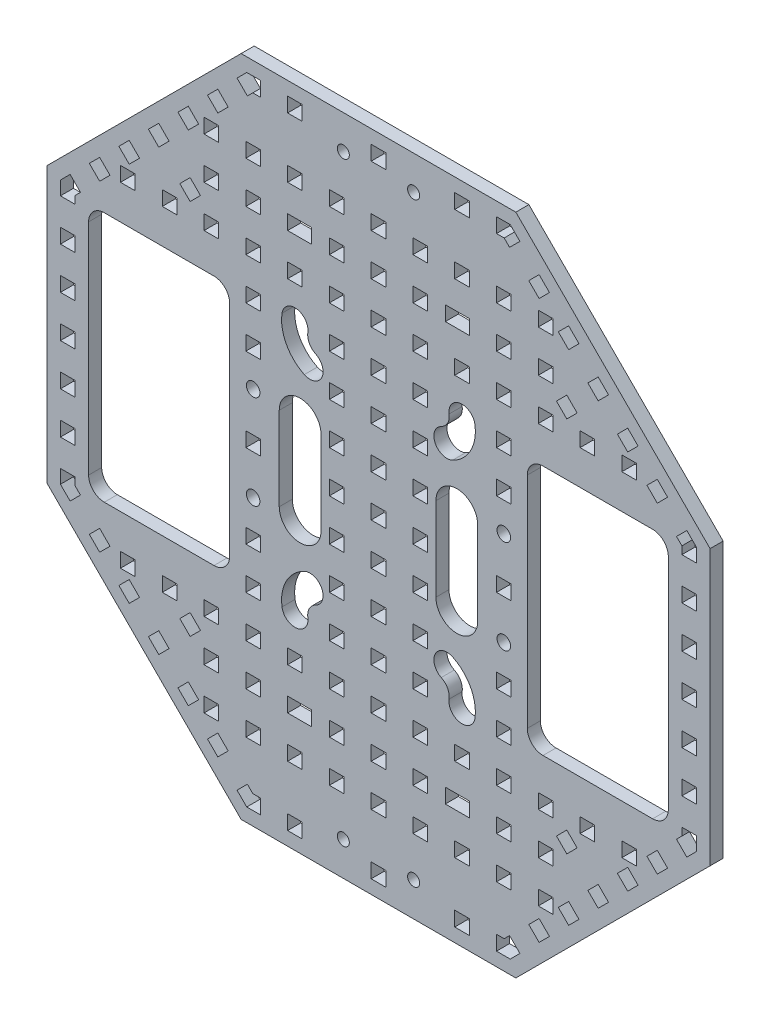
from build123d import *

# Parameters (mm, degrees)
RESSALTO_EXTRUS_O1_DEPTH = 2.5
ESBO_O2_R                = 1.3
ESBO_O2_R_2              = 1.15
CORTE_EXTRUS_O1_DEPTH    = 90.837353033
CORTE_EXTRUS_O2_DEPTH    = 10.5
ESBO_O5_W                = 2.8
ESBO_O5_H                = 2.8
CORTE_EXTRUS_O3_DEPTH    = 90.837353033
ESBO_O6_W                = 2.8
ESBO_O6_H                = 2.8
CORTE_EXTRUS_O4_DEPTH    = 90.837353033


with BuildPart() as part:
    # Esboço1 → Ressalto-extrusão1 (new body)
    with BuildSketch(Plane.XY):
        Polygon((63.5, -26.302561211), (63.5, 26.302561211), (26.302561211, 63.5), (-26.302561211, 63.5), (-63.5, 26.302561211), (-63.5, -26.302561211), (-26.302561211, -63.5), (26.302561211, -63.5), align=None)
    extrude(amount=RESSALTO_EXTRUS_O1_DEPTH)

    # Esboço2 → Corte-extrusão1 (cut, through all)
    with BuildSketch(Plane(origin=(0, 0, 0), x_dir=(-1, 0, 0), z_dir=(0, 0, -1))):
        with Locations((24, 9)):
            Circle(ESBO_O2_R)
        with Locations((24, -9)):
            Circle(ESBO_O2_R)
        with Locations((-24, -9)):
            Circle(ESBO_O2_R)
        with Locations((-24, 9)):
            Circle(ESBO_O2_R)
        with Locations((-6.731, -57)):
            Circle(ESBO_O2_R_2)
        with Locations((6.731, -57)):
            Circle(ESBO_O2_R_2)
        with Locations((6.731, 57)):
            Circle(ESBO_O2_R_2)
        with Locations((-6.731, 57)):
            Circle(ESBO_O2_R_2)
        with BuildLine():
            Line((52.5, 24), (31.5, 24))
            ThreePointArc((31.5, 24), (29.378679656, 23.121320344), (28.5, 21))
            Line((28.5, 21), (28.5, -21))
            ThreePointArc((28.5, -21), (29.378679656, -23.121320344), (31.5, -24))
            Line((31.5, -24), (52.5, -24))
            ThreePointArc((52.5, -24), (54.621320344, -23.121320344), (55.5, -21))
            Line((55.5, -21), (55.5, 21))
            ThreePointArc((55.5, 21), (54.621320344, 23.121320344), (52.5, 24))
        make_face()
        with BuildLine():
            Line((-28.5, 21), (-28.5, -21))
            ThreePointArc((-28.5, -21), (-29.378679656, -23.121320344), (-31.5, -24))
            Line((-31.5, -24), (-52.5, -24))
            ThreePointArc((-52.5, -24), (-54.621320344, -23.121320344), (-55.5, -21))
            Line((-55.5, -21), (-55.5, 21))
            ThreePointArc((-55.5, 21), (-54.621320344, 23.121320344), (-52.5, 24))
            Line((-52.5, 24), (-31.5, 24))
            ThreePointArc((-31.5, 24), (-29.378679656, 23.121320344), (-28.5, 21))
        make_face()
    extrude(amount=-CORTE_EXTRUS_O1_DEPTH, mode=Mode.SUBTRACT)

    # Esboço4 → Corte-extrusão2 (cut)
    with BuildSketch(Plane.XY.offset(2.5)):
        Polygon((-36.062445841, 34.082546853), (-34.082546853, 36.062445841), (-36.062445841, 38.042344828), (-38.042344828, 36.062445841), align=None)
        Polygon((36.062445841, 34.082546853), (38.042344828, 36.062445841), (36.062445841, 38.042344828), (34.082546853, 36.062445841), align=None)
        Polygon((36.062445841, -38.042344828), (38.042344828, -36.062445841), (36.062445841, -34.082546853), (34.082546853, -36.062445841), align=None)
        Polygon((-36.062445841, -38.042344828), (-34.082546853, -36.062445841), (-36.062445841, -34.082546853), (-38.042344828, -36.062445841), align=None)
    extrude(amount=-CORTE_EXTRUS_O2_DEPTH, mode=Mode.SUBTRACT)

    # Esboço5 → Corte-extrusão3 (cut, through all)
    with BuildSketch(Plane(origin=(0, 0, 0), x_dir=(-1, 0, 0), z_dir=(0, 0, -1))):
        Polygon((-47.72970773, -34.436100244), (-49.709606717, -36.415999231), (-47.72970773, -38.395898218), (-45.749808743, -36.415999231), align=None)
        Polygon((-42.072853481, -40.092954493), (-44.052752468, -42.072853481), (-42.072853481, -44.052752468), (-40.092954493, -42.072853481), align=None)
        Polygon((-53.38656198, -28.779245994), (-55.366460967, -30.759144982), (-53.38656198, -32.739043969), (-51.406662992, -30.759144982), align=None)
        with Locations((-8, 24)):
            Rectangle(ESBO_O5_W, ESBO_O5_H)
        Polygon((-25.225605949, -60.9), (-27.082189719, -59.043416229), (-25.102290732, -57.063517242), (-24.065807974, -58.1), (-22.6, -58.1), (-22.6, -60.9), align=None)
        Polygon((-30.759144982, -55.366460967), (-32.739043969, -53.38656198), (-30.759144982, -51.406662992), (-28.779245994, -53.38656198), align=None)
        Polygon((-36.415999231, -49.709606717), (-38.395898218, -47.72970773), (-36.415999231, -45.749808743), (-34.436100244, -47.72970773), align=None)
        with Locations((-8, 8)):
            Rectangle(ESBO_O5_W, ESBO_O5_H)
        with Locations((0, -59.5)):
            Rectangle(ESBO_O5_W, ESBO_O5_H)
        with Locations((-16, -59.5)):
            Rectangle(ESBO_O5_W, ESBO_O5_H)
        with Locations((8, 24)):
            Rectangle(ESBO_O5_W, ESBO_O5_H)
        with Locations((-8, 0)):
            Rectangle(ESBO_O5_W, ESBO_O5_H)
        with Locations((8, -24)):
            Rectangle(ESBO_O5_W, ESBO_O5_H)
        with Locations((-8, -24)):
            Rectangle(ESBO_O5_W, ESBO_O5_H)
        with Locations((-8, -8)):
            Rectangle(ESBO_O5_W, ESBO_O5_H)
        Polygon((24.065807974, -58.1), (25.102290732, -57.063517242), (27.082189719, -59.043416229), (25.225605949, -60.9), (22.6, -60.9), (22.6, -58.1), align=None)
        Polygon((60.9, -25.225605949), (59.043416229, -27.082189719), (57.063517242, -25.102290732), (58.1, -24.065807974), (58.1, -22.6), (60.9, -22.6), align=None)
        with Locations((59.5, -8)):
            Rectangle(ESBO_O5_W, ESBO_O5_H)
        with Locations((59.5, 0)):
            Rectangle(ESBO_O5_W, ESBO_O5_H)
        with Locations((16, -59.5)):
            Rectangle(ESBO_O5_W, ESBO_O5_H)
        with Locations((8, -8)):
            Rectangle(ESBO_O5_W, ESBO_O5_H)
        Polygon((34.436100244, -47.72970773), (36.415999231, -49.709606717), (38.395898218, -47.72970773), (36.415999231, -45.749808743), align=None)
        Polygon((40.092954493, -42.072853481), (42.072853481, -44.052752468), (44.052752468, -42.072853481), (42.072853481, -40.092954493), align=None)
        Polygon((28.779245994, -53.38656198), (30.759144982, -55.366460967), (32.739043969, -53.38656198), (30.759144982, -51.406662992), align=None)
        Polygon((55.366460967, -30.759144982), (53.38656198, -32.739043969), (51.406662992, -30.759144982), (53.38656198, -28.779245994), align=None)
        Polygon((49.709606717, -36.415999231), (47.72970773, -38.395898218), (45.749808743, -36.415999231), (47.72970773, -34.436100244), align=None)
        with Locations((59.5, -16)):
            Rectangle(ESBO_O5_W, ESBO_O5_H)
        with Locations((8, 0)):
            Rectangle(ESBO_O5_W, ESBO_O5_H)
        Polygon((58.1, 24.065807974), (57.063517242, 25.102290732), (59.043416229, 27.082189719), (60.9, 25.225605949), (60.9, 22.6), (58.1, 22.6), align=None)
        Polygon((47.72970773, 34.436100244), (49.709606717, 36.415999231), (47.72970773, 38.395898218), (45.749808743, 36.415999231), align=None)
        Polygon((42.072853481, 40.092954493), (44.052752468, 42.072853481), (42.072853481, 44.052752468), (40.092954493, 42.072853481), align=None)
        Polygon((53.38656198, 28.779245994), (55.366460967, 30.759144982), (53.38656198, 32.739043969), (51.406662992, 30.759144982), align=None)
        with Locations((59.5, 16)):
            Rectangle(ESBO_O5_W, ESBO_O5_H)
        Polygon((25.225605949, 60.9), (27.082189719, 59.043416229), (25.102290732, 57.063517242), (24.065807974, 58.1), (22.6, 58.1), (22.6, 60.9), align=None)
        Polygon((30.759144982, 55.366460967), (32.739043969, 53.38656198), (30.759144982, 51.406662992), (28.779245994, 53.38656198), align=None)
        Polygon((36.415999231, 49.709606717), (38.395898218, 47.72970773), (36.415999231, 45.749808743), (34.436100244, 47.72970773), align=None)
        with Locations((8, 8)):
            Rectangle(ESBO_O5_W, ESBO_O5_H)
        with Locations((16, 59.5)):
            Rectangle(ESBO_O5_W, ESBO_O5_H)
        with Locations((59.5, 8)):
            Rectangle(ESBO_O5_W, ESBO_O5_H)
        Polygon((-24.065807974, 58.1), (-25.102290732, 57.063517242), (-27.082189719, 59.043416229), (-25.225605949, 60.9), (-22.6, 60.9), (-22.6, 58.1), align=None)
        with Locations((-16, 59.5)):
            Rectangle(ESBO_O5_W, ESBO_O5_H)
        with Locations((0, 59.5)):
            Rectangle(ESBO_O5_W, ESBO_O5_H)
        Polygon((-34.436100244, 47.72970773), (-36.415999231, 49.709606717), (-38.395898218, 47.72970773), (-36.415999231, 45.749808743), align=None)
        Polygon((-40.092954493, 42.072853481), (-42.072853481, 44.052752468), (-44.052752468, 42.072853481), (-42.072853481, 40.092954493), align=None)
        Polygon((-28.779245994, 53.38656198), (-30.759144982, 55.366460967), (-32.739043969, 53.38656198), (-30.759144982, 51.406662992), align=None)
        Polygon((-55.366460967, 30.759144982), (-53.38656198, 32.739043969), (-51.406662992, 30.759144982), (-53.38656198, 28.779245994), align=None)
        Polygon((-49.709606717, 36.415999231), (-47.72970773, 38.395898218), (-45.749808743, 36.415999231), (-47.72970773, 34.436100244), align=None)
        Rectangle(ESBO_O5_W, ESBO_O5_H)
        with Locations((24, 0)):
            Rectangle(ESBO_O5_W, ESBO_O5_H)
        with Locations((8, 16)):
            Rectangle(ESBO_O5_W, ESBO_O5_H)
        with Locations((24, 16)):
            Rectangle(ESBO_O5_W, ESBO_O5_H)
        with Locations((16, 24)):
            Rectangle(ESBO_O5_W, ESBO_O5_H)
        with Locations((24, 24)):
            Rectangle(ESBO_O5_W, ESBO_O5_H)
        with Locations((8, 32)):
            Rectangle(ESBO_O5_W, ESBO_O5_H)
        with Locations((16, 32)):
            Rectangle(ESBO_O5_W, ESBO_O5_H)
        with Locations((24, 32)):
            Rectangle(ESBO_O5_W, ESBO_O5_H)
        with Locations((32, 32)):
            Rectangle(ESBO_O5_W, ESBO_O5_H)
        with Locations((40, 32)):
            Rectangle(ESBO_O5_W, ESBO_O5_H)
        with Locations((48, 32)):
            Rectangle(ESBO_O5_W, ESBO_O5_H)
        with Locations((8, 40)):
            Rectangle(ESBO_O5_W, ESBO_O5_H)
        with Locations((16, 40)):
            Rectangle(ESBO_O5_W, ESBO_O5_H)
        with Locations((24, 40)):
            Rectangle(ESBO_O5_W, ESBO_O5_H)
        with Locations((32, 40)):
            Rectangle(ESBO_O5_W, ESBO_O5_H)
        with Locations((8, 48)):
            Rectangle(ESBO_O5_W, ESBO_O5_H)
        with Locations((16, 48)):
            Rectangle(ESBO_O5_W, ESBO_O5_H)
        with Locations((24, 48)):
            Rectangle(ESBO_O5_W, ESBO_O5_H)
        with Locations((32, 48)):
            Rectangle(ESBO_O5_W, ESBO_O5_H)
        with Locations((0, 8)):
            Rectangle(ESBO_O5_W, ESBO_O5_H)
        with Locations((0, 16)):
            Rectangle(ESBO_O5_W, ESBO_O5_H)
        with Locations((0, 24)):
            Rectangle(ESBO_O5_W, ESBO_O5_H)
        with Locations((0, 32)):
            Rectangle(ESBO_O5_W, ESBO_O5_H)
        with Locations((0, 40)):
            Rectangle(ESBO_O5_W, ESBO_O5_H)
        with Locations((0, 48)):
            Rectangle(ESBO_O5_W, ESBO_O5_H)
        with Locations((-32, 48)):
            Rectangle(ESBO_O5_W, ESBO_O5_H)
        with Locations((-24, 48)):
            Rectangle(ESBO_O5_W, ESBO_O5_H)
        with Locations((-16, 48)):
            Rectangle(ESBO_O5_W, ESBO_O5_H)
        with Locations((-8, 48)):
            Rectangle(ESBO_O5_W, ESBO_O5_H)
        with Locations((-32, 40)):
            Rectangle(ESBO_O5_W, ESBO_O5_H)
        with Locations((-24, 40)):
            Rectangle(ESBO_O5_W, ESBO_O5_H)
        with Locations((-16, 40)):
            Rectangle(ESBO_O5_W, ESBO_O5_H)
        with Locations((-8, 40)):
            Rectangle(ESBO_O5_W, ESBO_O5_H)
        with Locations((-48, 32)):
            Rectangle(ESBO_O5_W, ESBO_O5_H)
        with Locations((-40, 32)):
            Rectangle(ESBO_O5_W, ESBO_O5_H)
        with Locations((-32, 32)):
            Rectangle(ESBO_O5_W, ESBO_O5_H)
        with Locations((-24, 32)):
            Rectangle(ESBO_O5_W, ESBO_O5_H)
        with Locations((-16, 32)):
            Rectangle(ESBO_O5_W, ESBO_O5_H)
        with Locations((-8, 32)):
            Rectangle(ESBO_O5_W, ESBO_O5_H)
        with Locations((-24, 24)):
            Rectangle(ESBO_O5_W, ESBO_O5_H)
        with Locations((-16, 24)):
            Rectangle(ESBO_O5_W, ESBO_O5_H)
        with Locations((-24, 16)):
            Rectangle(ESBO_O5_W, ESBO_O5_H)
        with Locations((-8, 16)):
            Rectangle(ESBO_O5_W, ESBO_O5_H)
        with Locations((-24, 0)):
            Rectangle(ESBO_O5_W, ESBO_O5_H)
        with Locations((48, -32)):
            Rectangle(ESBO_O5_W, ESBO_O5_H)
        with Locations((40, -32)):
            Rectangle(ESBO_O5_W, ESBO_O5_H)
        with Locations((-48, -32)):
            Rectangle(ESBO_O5_W, ESBO_O5_H)
        with Locations((-40, -32)):
            Rectangle(ESBO_O5_W, ESBO_O5_H)
        with Locations((-8, -16)):
            Rectangle(ESBO_O5_W, ESBO_O5_H)
        with Locations((-24, -16)):
            Rectangle(ESBO_O5_W, ESBO_O5_H)
        with Locations((-16, -24)):
            Rectangle(ESBO_O5_W, ESBO_O5_H)
        with Locations((-24, -24)):
            Rectangle(ESBO_O5_W, ESBO_O5_H)
        with Locations((-8, -32)):
            Rectangle(ESBO_O5_W, ESBO_O5_H)
        with Locations((-16, -32)):
            Rectangle(ESBO_O5_W, ESBO_O5_H)
        with Locations((-24, -32)):
            Rectangle(ESBO_O5_W, ESBO_O5_H)
        with Locations((-32, -32)):
            Rectangle(ESBO_O5_W, ESBO_O5_H)
        with Locations((-8, -40)):
            Rectangle(ESBO_O5_W, ESBO_O5_H)
        with Locations((-16, -40)):
            Rectangle(ESBO_O5_W, ESBO_O5_H)
        with Locations((-24, -40)):
            Rectangle(ESBO_O5_W, ESBO_O5_H)
        with Locations((-32, -40)):
            Rectangle(ESBO_O5_W, ESBO_O5_H)
        with Locations((-8, -48)):
            Rectangle(ESBO_O5_W, ESBO_O5_H)
        with Locations((-16, -48)):
            Rectangle(ESBO_O5_W, ESBO_O5_H)
        with Locations((-24, -48)):
            Rectangle(ESBO_O5_W, ESBO_O5_H)
        with Locations((-32, -48)):
            Rectangle(ESBO_O5_W, ESBO_O5_H)
        with Locations((0, -48)):
            Rectangle(ESBO_O5_W, ESBO_O5_H)
        with Locations((0, -40)):
            Rectangle(ESBO_O5_W, ESBO_O5_H)
        with Locations((0, -32)):
            Rectangle(ESBO_O5_W, ESBO_O5_H)
        with Locations((0, -24)):
            Rectangle(ESBO_O5_W, ESBO_O5_H)
        with Locations((0, -16)):
            Rectangle(ESBO_O5_W, ESBO_O5_H)
        with Locations((0, -8)):
            Rectangle(ESBO_O5_W, ESBO_O5_H)
        with Locations((32, -48)):
            Rectangle(ESBO_O5_W, ESBO_O5_H)
        with Locations((24, -48)):
            Rectangle(ESBO_O5_W, ESBO_O5_H)
        with Locations((16, -48)):
            Rectangle(ESBO_O5_W, ESBO_O5_H)
        with Locations((8, -48)):
            Rectangle(ESBO_O5_W, ESBO_O5_H)
        with Locations((32, -40)):
            Rectangle(ESBO_O5_W, ESBO_O5_H)
        with Locations((24, -40)):
            Rectangle(ESBO_O5_W, ESBO_O5_H)
        with Locations((16, -40)):
            Rectangle(ESBO_O5_W, ESBO_O5_H)
        with Locations((8, -40)):
            Rectangle(ESBO_O5_W, ESBO_O5_H)
        with Locations((32, -32)):
            Rectangle(ESBO_O5_W, ESBO_O5_H)
        with Locations((24, -32)):
            Rectangle(ESBO_O5_W, ESBO_O5_H)
        with Locations((16, -32)):
            Rectangle(ESBO_O5_W, ESBO_O5_H)
        with Locations((8, -32)):
            Rectangle(ESBO_O5_W, ESBO_O5_H)
        with Locations((24, -24)):
            Rectangle(ESBO_O5_W, ESBO_O5_H)
        with Locations((16, -24)):
            Rectangle(ESBO_O5_W, ESBO_O5_H)
        with Locations((24, -16)):
            Rectangle(ESBO_O5_W, ESBO_O5_H)
        with Locations((8, -16)):
            Rectangle(ESBO_O5_W, ESBO_O5_H)
        Polygon((-60.9, 25.225605949), (-59.043416229, 27.082189719), (-57.063517242, 25.102290732), (-58.1, 24.065807974), (-58.1, 22.6), (-60.9, 22.6), align=None)
        with Locations((-59.5, 8)):
            Rectangle(ESBO_O5_W, ESBO_O5_H)
        with Locations((-59.5, 16)):
            Rectangle(ESBO_O5_W, ESBO_O5_H)
        Polygon((-58.1, -24.065807974), (-57.063517242, -25.102290732), (-59.043416229, -27.082189719), (-60.9, -25.225605949), (-60.9, -22.6), (-58.1, -22.6), align=None)
        with Locations((-59.5, -16)):
            Rectangle(ESBO_O5_W, ESBO_O5_H)
        with Locations((-59.5, -8)):
            Rectangle(ESBO_O5_W, ESBO_O5_H)
        with Locations((-59.5, 0)):
            Rectangle(ESBO_O5_W, ESBO_O5_H)
    extrude(amount=-CORTE_EXTRUS_O3_DEPTH, mode=Mode.SUBTRACT)

    # Esboço6 → Corte-extrusão4 (cut, through all)
    with BuildSketch(Plane(origin=(0, 0, 0), x_dir=(-1, 0, 0), z_dir=(0, 0, -1))):
        with BuildLine():
            Line((-11, 8), (-11, -8))
            ThreePointArc((-11, -8), (-15, -12), (-19, -8))
            Line((-19, -8), (-19, 8))
            ThreePointArc((-19, 8), (-15, 12), (-11, 8))
        make_face()
        with BuildLine():
            Line((11, 8), (11, -8))
            ThreePointArc((11, -8), (15, -12), (19, -8))
            Line((19, -8), (19, 8))
            ThreePointArc((19, 8), (15, 12), (11, 8))
        make_face()
        with Locations((-14.2, 40)):
            Rectangle(ESBO_O6_W, ESBO_O6_H)
        with Locations((14.2, 40)):
            Rectangle(ESBO_O6_W, ESBO_O6_H)
        with Locations((14.2, -40)):
            Rectangle(ESBO_O6_W, ESBO_O6_H)
        with Locations((-14.2, -40)):
            Rectangle(ESBO_O6_W, ESBO_O6_H)
        with BuildLine():
            ThreePointArc((14.200297969, 16.315145811), (17.649253561, 19.637251237), (18.474772288, 24.354262787))
            ThreePointArc((18.474772288, 24.354262787), (15.645737213, 26.474772288), (13.525227712, 23.645737213))
            ThreePointArc((13.525227712, 23.645737213), (13.234515597, 21.984609051), (12.01994209, 20.814706705))
            ThreePointArc((12.01994209, 20.814706705), (10.860339583, 17.474748318), (14.200297969, 16.315145811))
        make_face()
        with BuildLine():
            ThreePointArc((-14.200297969, 16.315145811), (-17.649253561, 19.637251237), (-18.474772288, 24.354262787))
            ThreePointArc((-18.474772288, 24.354262787), (-15.645737213, 26.474772288), (-13.525227712, 23.645737213))
            ThreePointArc((-13.525227712, 23.645737213), (-13.234515597, 21.984609051), (-12.01994209, 20.814706705))
            ThreePointArc((-12.01994209, 20.814706705), (-10.860339583, 17.474748318), (-14.200297969, 16.315145811))
        make_face()
        with BuildLine():
            ThreePointArc((-14.200297969, -16.315145811), (-17.649253561, -19.637251237), (-18.474772288, -24.354262787))
            ThreePointArc((-18.474772288, -24.354262787), (-15.645737213, -26.474772288), (-13.525227712, -23.645737213))
            ThreePointArc((-13.525227712, -23.645737213), (-13.234515597, -21.984609051), (-12.01994209, -20.814706705))
            ThreePointArc((-12.01994209, -20.814706705), (-10.860339583, -17.474748318), (-14.200297969, -16.315145811))
        make_face()
        with BuildLine():
            ThreePointArc((14.200297969, -16.315145811), (17.649253561, -19.637251237), (18.474772288, -24.354262787))
            ThreePointArc((18.474772288, -24.354262787), (15.645737213, -26.474772288), (13.525227712, -23.645737213))
            ThreePointArc((13.525227712, -23.645737213), (13.234515597, -21.984609051), (12.01994209, -20.814706705))
            ThreePointArc((12.01994209, -20.814706705), (10.860339583, -17.474748318), (14.200297969, -16.315145811))
        make_face()
    extrude(amount=-CORTE_EXTRUS_O4_DEPTH, mode=Mode.SUBTRACT)


solid = part.part
